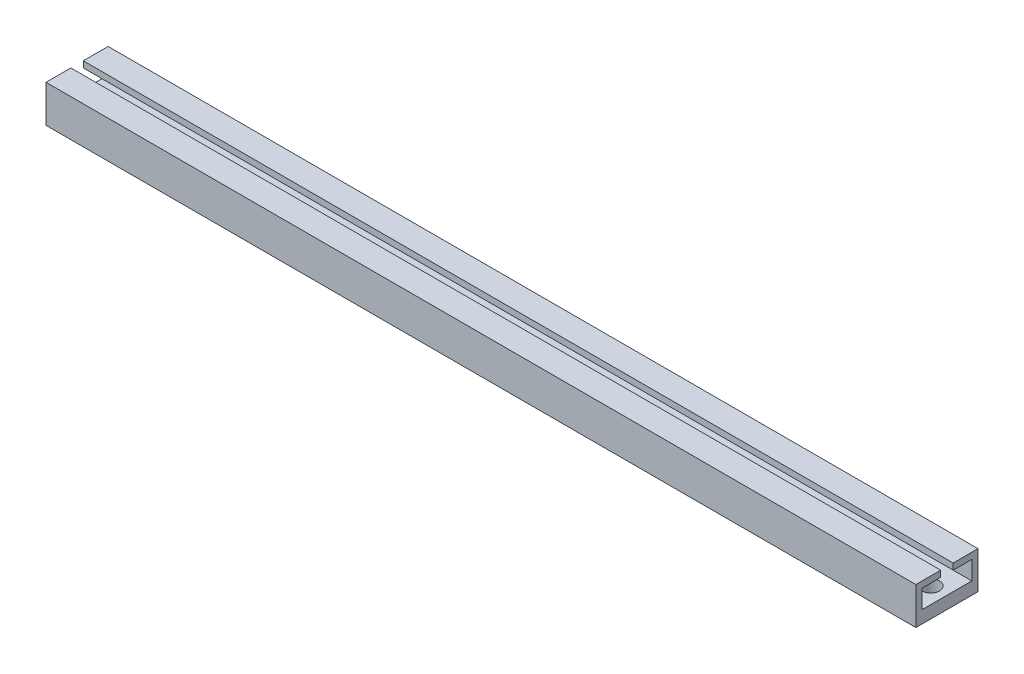
from build123d import *

# Parameters (mm, degrees)
BOSS_EXTRUDE1_DEPTH                 = 177.8
F_9_64_0_14063_DIAMETER_HOLE1_D     = 3.572002
F_9_64_0_14063_DIAMETER_HOLE1_DEPTH = 2.54
CUT_EXTRUDE1_START                  = -2.54
CUT_EXTRUDE1_DEPTH                  = 2.54
LPATTERN1_COUNT                     = 9
LPATTERN1_PITCH                     = 19.05


# Read off the part's stored shape, not the designer's step: Cut-Extrude1
with BuildPart() as part:
    # Sketch2 → Boss-Extrude1 (new body)
    with BuildSketch(Plane(origin=(0, 0, 0), x_dir=(0, 0, -1), z_dir=(1, 0, 0))):
        Polygon((-6.35, 0), (6.35, 0), (6.35, 7.62), (1.27, 7.62), (1.27, 6.35), (5.08, 6.35), (5.08, 2.54), (-5.08, 2.54), (-5.08, 6.35), (-1.27, 6.35), (-1.27, 7.62), (-6.35, 7.62), align=None)
    extrude(amount=BOSS_EXTRUDE1_DEPTH)

    # 9/64 (0.14063) Diameter Hole1
    with Locations(Plane(origin=(0, 2.54, 0), x_dir=(-1, 0, 0), z_dir=(0, 1, 0))):
        with Locations((-3.302, 0), (-174.498, 0)):
            Hole(F_9_64_0_14063_DIAMETER_HOLE1_D / 2, depth=F_9_64_0_14063_DIAMETER_HOLE1_DEPTH)

    # Cut-Extrude1 outline → Cut-Extrude1 (cut)
    with BuildSketch(Plane(origin=(0, 2.54, 0), x_dir=(1, 0, 0), z_dir=(0, 1, 0)).offset(CUT_EXTRUDE1_START)):
        with BuildLine():
            Line((15.875, 3.175), (9.525, 3.175))
            ThreePointArc((9.525, 3.175), (6.35, 0), (9.525, -3.175))
            Line((9.525, -3.175), (15.875, -3.175))
            ThreePointArc((15.875, -3.175), (19.05, 0), (15.875, 3.175))
        make_face()
    cut_extrude1 = extrude(amount=CUT_EXTRUDE1_DEPTH, mode=Mode.SUBTRACT)

    # LPattern1: Cut-Extrude1 ×9
    with Locations(*[(i * LPATTERN1_PITCH, 0, 0) for i in range(1, LPATTERN1_COUNT)]):
        add(cut_extrude1, mode=Mode.SUBTRACT)


solid = part.part
